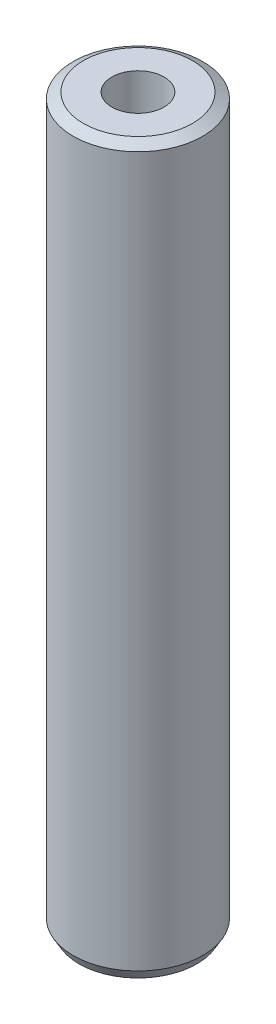
from build123d import *
from OCP.BRepFilletAPI import BRepFilletAPI_MakeChamfer

# Parameters (mm, degrees)
SKETCH1_R           = 37.5
BOSS_EXTRUDE1_DEPTH = 419.983161328
SKETCH2_R           = 15.11415525
CUT_EXTRUDE1_DEPTH  = 424.318267737
CHAMFER1_SIZE       = 3.43899154
CHAMFER1_SIZE2      = 5.956508075


with BuildPart() as part:
    # Sketch1 → Boss-Extrude1 (new body)
    with BuildSketch(Plane(origin=(0, 0, 0), x_dir=(1, 0, 0), z_dir=(0, 1, 0))):
        Circle(SKETCH1_R)
    extrude(amount=BOSS_EXTRUDE1_DEPTH)

    # Sketch2 → Cut-Extrude1 (cut, through all)
    with BuildSketch(Plane(origin=(0, 0, 0), x_dir=(1, 0, 0), z_dir=(0, 1, 0))):
        Circle(SKETCH2_R)
    extrude(amount=CUT_EXTRUDE1_DEPTH, mode=Mode.SUBTRACT)

    # Chamfer1: one chamfer whose edges measure the first distance from different faces: ONE call of the kernel's chamfer builder (chamfer() names one face for all edges)
    chamfer1_edges_1 = [part.edges().sort_by_distance(p)[0] for p in [
        (-37.5, 419.983161328, 0),
    ]]
    chamfer1_side_1 = [part.faces().sort_by_distance(p)[0] for p in [
        (-37.5, 209.991580664, 0),
    ]]
    chamfer1_edges_2 = [part.edges().sort_by_distance(p)[0] for p in [
        (-37.5, 0, 0),
    ]]
    chamfer1_side_2 = [part.faces().sort_by_distance(p)[0] for p in [
        (-36.439339828, 0, 0),
    ]]
    chamfer1 = BRepFilletAPI_MakeChamfer(part.part.solid().wrapped)
    for e in chamfer1_edges_1:
        chamfer1.Add(CHAMFER1_SIZE, CHAMFER1_SIZE2, e.wrapped, chamfer1_side_1[0].wrapped)  # the first distance lies on this face
    for e in chamfer1_edges_2:
        chamfer1.Add(CHAMFER1_SIZE, CHAMFER1_SIZE2, e.wrapped, chamfer1_side_2[0].wrapped)  # the first distance lies on this face
    add(Compound.cast(chamfer1.Shape()), mode=Mode.REPLACE)


solid = part.part
